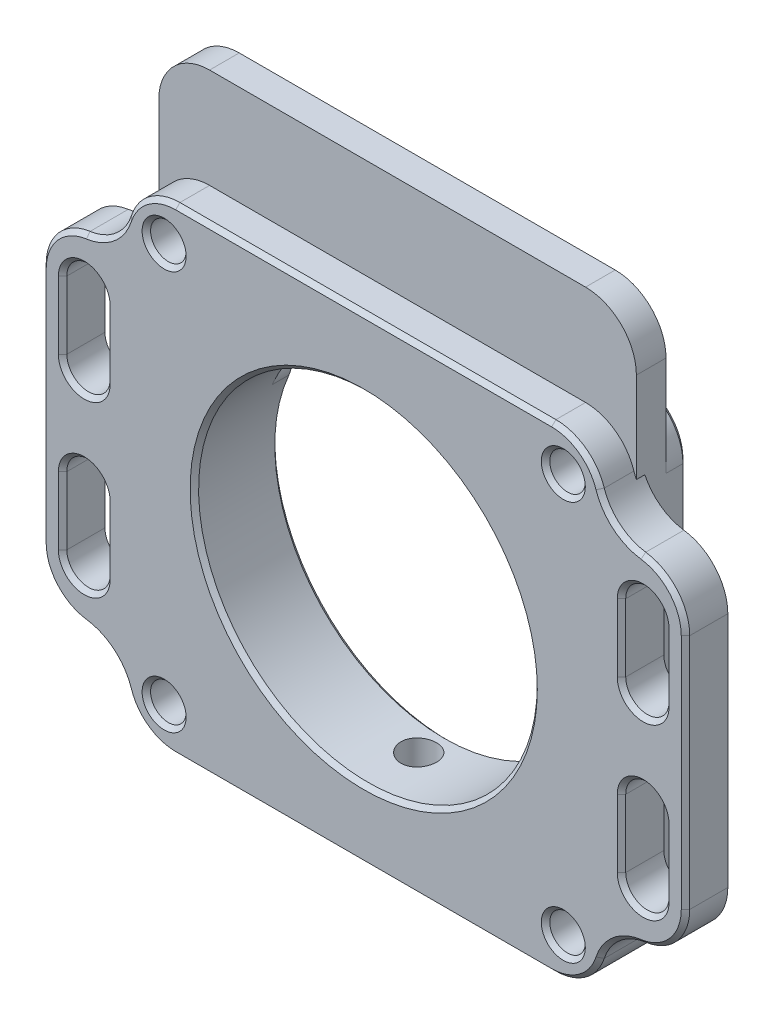
from build123d import *

# Parameters (mm, degrees)
SKETCH1_R                   = 20
BOSS_EXTRUDE1_DEPTH         = 10
FILLET1_R                   = 6
TAP_DRILL_FOR_M5_TAP1_D     = 4.2
CUT_EXTRUDE2_START          = 5
SKETCH4_OUTSIDE_W           = 97.034
SKETCH4_OUTSIDE_H           = 77.434
SKETCH4_OUTSIDE_W_2         = 56.4
SKETCH4_OUTSIDE_H_2         = 56.4
CUT_EXTRUDE2_DEPTH          = 44.365690319
FILLET2_R                   = 6
FILLET3_R                   = 6
TAP_DRILL_FOR_M5_TAP2_D     = 4.2
TAP_DRILL_FOR_M5_TAP2_DEPTH = 20
TAP_DRILL_FOR_M5_TAP2_TIP   = 1.2618073
BOSS_EXTRUDE2_START         = -6
BOSS_EXTRUDE2_DEPTH         = 3.5
SKETCH10_W                  = 36
SKETCH10_H                  = 49.806381251
CUT_EXTRUDE3_DEPTH          = 2.5
FILLET4_R                   = 4
CHAMFER1_SIZE               = 0.5


with BuildPart() as part:
    # Sketch1 → Boss-Extrude1 (new body)
    with BuildSketch(Plane.XY):
        Polygon((-28.2, -20), (-38, -20), (-38, 20), (-28.2, 20), (-28.2, 28.2), (28.2, 28.2), (28.2, 20), (38, 20), (38, -20), (28.2, -20), (28.2, -28.2), (-28.2, -28.2), align=None)
        Circle(SKETCH1_R, mode=Mode.SUBTRACT)
        with BuildLine():
            Line((-35.559242748, 6), (-35.559242748, 14))
            ThreePointArc((-35.559242748, 14), (-33, 16.559242748), (-30.440757252, 14))
            Line((-30.440757252, 14), (-30.440757252, 6))
            ThreePointArc((-30.440757252, 6), (-33, 3.440757252), (-35.559242748, 6))
        make_face(mode=Mode.SUBTRACT)
        with BuildLine():
            Line((-30.440757252, -6), (-30.440757252, -14))
            ThreePointArc((-30.440757252, -14), (-33, -16.559242748), (-35.559242748, -14))
            Line((-35.559242748, -14), (-35.559242748, -6))
            ThreePointArc((-35.559242748, -6), (-33, -3.440757252), (-30.440757252, -6))
        make_face(mode=Mode.SUBTRACT)
        with BuildLine():
            Line((35.559242748, -6), (35.559242748, -14))
            ThreePointArc((35.559242748, -14), (33, -16.559242748), (30.440757252, -14))
            Line((30.440757252, -14), (30.440757252, -6))
            ThreePointArc((30.440757252, -6), (33, -3.440757252), (35.559242748, -6))
        make_face(mode=Mode.SUBTRACT)
        with BuildLine():
            Line((30.440757252, 6), (30.440757252, 14))
            ThreePointArc((30.440757252, 14), (33, 16.559242748), (35.559242748, 14))
            Line((35.559242748, 14), (35.559242748, 6))
            ThreePointArc((35.559242748, 6), (33, 3.440757252), (30.440757252, 6))
        make_face(mode=Mode.SUBTRACT)
    extrude(amount=BOSS_EXTRUDE1_DEPTH)

    # Fillet1
    fillet1_edges = [part.edges().sort_by_distance(p)[0] for p in [
        (-28.2, 28.2, 5),
        (28.2, 28.2, 5),
        (28.2, -28.2, 5),
        (-28.2, -28.2, 5),
    ]]
    fillet(fillet1_edges, radius=FILLET1_R)

    # Tap Drill for M5 Tap1 (through all)
    with Locations(Plane.XY.offset(10)):
        with Locations((0, 0), (23.57, -23.57), (-23.57, 23.57), (-23.57, -23.57), (23.57, 23.57)):
            Hole(TAP_DRILL_FOR_M5_TAP1_D / 2)

    # Sketch4 outside → Cut-Extrude2 (cut, through all)
    with BuildSketch(Plane(origin=(0, 0, 10), x_dir=(-1, 0, 0), z_dir=(0, 0, -1)).offset(CUT_EXTRUDE2_START)):
        Rectangle(SKETCH4_OUTSIDE_W, SKETCH4_OUTSIDE_H)
        Rectangle(SKETCH4_OUTSIDE_W_2, SKETCH4_OUTSIDE_H_2, mode=Mode.SUBTRACT)
    extrude(amount=CUT_EXTRUDE2_DEPTH, mode=Mode.SUBTRACT)

    # Fillet2
    fillet2_edges = [part.edges().sort_by_distance(p)[0] for p in [
        (38, 20, 7.5),
        (38, -20, 7.5),
        (-38, -20, 7.5),
        (-38, 20, 7.5),
    ]]
    fillet(fillet2_edges, radius=FILLET2_R)

    # Fillet3
    # the kernel refuses this fillet: 6 mm, written as the material it adds along each edge
    with BuildSketch(Plane(origin=(-28.2, -20, 5), x_dir=(0.07169544842088547, -0.9974265700670543, 0), z_dir=(0, 0, 1)), Plane(origin=(28.2, 20, 5), x_dir=(-0.0716954484208838, 0.9974265700670545, 0), z_dir=(0, 0, 1))) as fillet3_piece_1:
        with BuildLine():
            CenterArc((5.486719207, -5.826829434), FILLET3_R, 103.799048999, 64.338369747)
            Line((-0.385141459, -4.593438855), (-0.972327525, -4.470099797))
            ThreePointArc((-0.972327525, -4.470099797), (-0.870898646, -3.747203697), (-0.598455942, 0.043017269))
            Line((-0.598455942, 0.043017269), (0.043017269, 0.598455942))
            ThreePointArc((0.043017269, 0.598455942), (2.237355723, 0.440725956), (3.912504773, 0.582682943))
            Line((3.912504773, 0.582682943), (4.055615176, 0))
        make_face()
    extrude(amount=5)
    with BuildSketch(Plane(origin=(-28.2, 20, 5), x_dir=(-0.9999292752437037, -0.011893044631264506, 0), z_dir=(0, 0, 1)), Plane(origin=(28.2, -20, 5), x_dir=(0.9999292752437039, 0.011893044631263755, 0), z_dir=(0, 0, 1))) as fillet3_piece_2:
        with BuildLine():
            CenterArc((5.348024209, -5.954382082), FILLET3_R, 97.069769939, 64.338369747)
            Line((-0.338858071, -4.04143411), (-0.907546298, -3.850139313))
            ThreePointArc((-0.907546298, -3.850139313), (-0.626122263, -2.192708579), (-0.599957565, 0.007135827))
            Line((-0.599957565, 0.007135827), (0.007135827, 0.599957565))
            ThreePointArc((0.007135827, 0.599957565), (3.806867073, 0.554763996), (4.535710126, 0.595438208))
            Line((4.535710126, 0.595438208), (4.609556861, 0))
        make_face()
    extrude(amount=5)

    # Tap Drill for M5 Tap2
    with Locations(Plane(origin=(0, -28.2, 0), x_dir=(-1, 0, 0), z_dir=(0, -1, 0))):
        with Locations((0, -3.5)):
            Hole(TAP_DRILL_FOR_M5_TAP2_D / 2, depth=TAP_DRILL_FOR_M5_TAP2_DEPTH)
            with Locations((0, 0, -(TAP_DRILL_FOR_M5_TAP2_DEPTH + TAP_DRILL_FOR_M5_TAP2_TIP / 2))):  # 118° drill point
                Cone(0, TAP_DRILL_FOR_M5_TAP2_D / 2, TAP_DRILL_FOR_M5_TAP2_TIP, mode=Mode.SUBTRACT)

    # Sketch9 → Boss-Extrude2 (add)
    with BuildSketch(Plane(origin=(0, 0, 0), x_dir=(-1, 0, 0), z_dir=(0, 0, -1)).offset(BOSS_EXTRUDE2_START)):
        with BuildLine():
            Line((-28.2, 22.2), (-28.2, 34))
            ThreePointArc((-28.2, 34), (-26.442640687, 38.242640687), (-22.2, 40))
            Line((-22.2, 40), (22.2, 40))
            ThreePointArc((22.2, 40), (26.442640687, 38.242640687), (28.2, 34))
            Line((28.2, 34), (28.2, 22.2))
            ThreePointArc((28.2, 22.2), (26.442640687, 26.442640687), (22.2, 28.2))
            Line((22.2, 28.2), (-22.2, 28.2))
            ThreePointArc((-22.2, 28.2), (-26.442640687, 26.442640687), (-28.2, 22.2))
        make_face()
    extrude(amount=BOSS_EXTRUDE2_DEPTH)

    # Sketch10 → Cut-Extrude3 (cut)
    with BuildSketch(Plane(origin=(0, 0, 0), x_dir=(-1, 0, 0), z_dir=(0, 0, -1))):
        with Locations((0, 24.903190626)):
            Rectangle(SKETCH10_W, SKETCH10_H)
    extrude(amount=-CUT_EXTRUDE3_DEPTH, mode=Mode.SUBTRACT)

    # Fillet4
    fillet4_edges = [part.edges().sort_by_distance(p)[0] for p in [
        (-18, 28.2, 1.25),
        (-18, 8.717797887, 1.25),
        (18, 28.2, 1.25),
        (18, 8.717797887, 1.25),
    ]]
    fillet(fillet4_edges, radius=FILLET4_R)

    # Chamfer1
    chamfer1_edges = [part.edges().sort_by_distance(p)[0] for p in [
        (0, -28.2, 10),
        (25.730504921, -27.051343629, 10),
        (-25.730504921, 27.051343629, 10),
        (28.2, 0, 0),
        (25.67, 23.57, 10),
        (25.67, 23.57, 0),
        (-21.47, -23.57, 10),
        (-21.47, -23.57, 0),
        (-21.47, 23.57, 10),
        (-21.47, 23.57, 0),
        (-28.2, 0, 0),
        (25.67, -23.57, 10),
        (25.67, -23.57, 0),
        (38, 0, 10),
        (-38, 0, 10),
        (-36.519700494, -17.946176307, 10),
        (36.519700494, 17.946176307, 10),
        (-25.730504921, -27.051343629, 10),
        (-36.519700494, 17.946176307, 10),
        (25.730504921, 27.051343629, 10),
        (36.519700494, -17.946176307, 10),
        (-29.768125907, -21.28873584, 10),
        (-29.768125907, 21.28873584, 10),
        (29.768125907, 21.28873584, 10),
        (29.768125907, -21.28873584, 10),
        (-33, 3.440757252, 10),
        (-30.440757252, 10, 10),
        (-33, 16.559242748, 10),
        (-35.559242748, 10, 10),
        (-22.1, 28.2, 0),
        (-18, 16.895831523, 0),
        (-4.082482905, -19.578900207, 0),
        (18, 16.895831523, 0),
        (-18.084219959, 8.775166466, 0),
        (18.084219959, 8.775166466, 0),
        (19.171572875, 27.028427125, 0),
        (-19.171572875, 27.028427125, 0),
        (-33, -3.440757252, 10),
        (-35.559242748, -10, 10),
        (-33, -16.559242748, 10),
        (-30.440757252, -10, 10),
        (33, -3.440757252, 10),
        (30.440757252, -10, 10),
        (33, -16.559242748, 10),
        (35.559242748, -10, 10),
        (33, 3.440757252, 10),
        (35.559242748, 10, 10),
        (33, 16.559242748, 10),
        (30.440757252, 10, 10),
        (-20, 0, 10),
        (22.1, 28.2, 0),
        (0, 28.2, 10),
        (0, -28.2, 0),
        (26.442640687, -26.442640687, 0),
        (-26.442640687, -26.442640687, 0),
        (-26.442640687, 26.442640687, 0),
        (26.442640687, 26.442640687, 0),
    ]]
    chamfer(chamfer1_edges, length=CHAMFER1_SIZE)


solid = part.part
